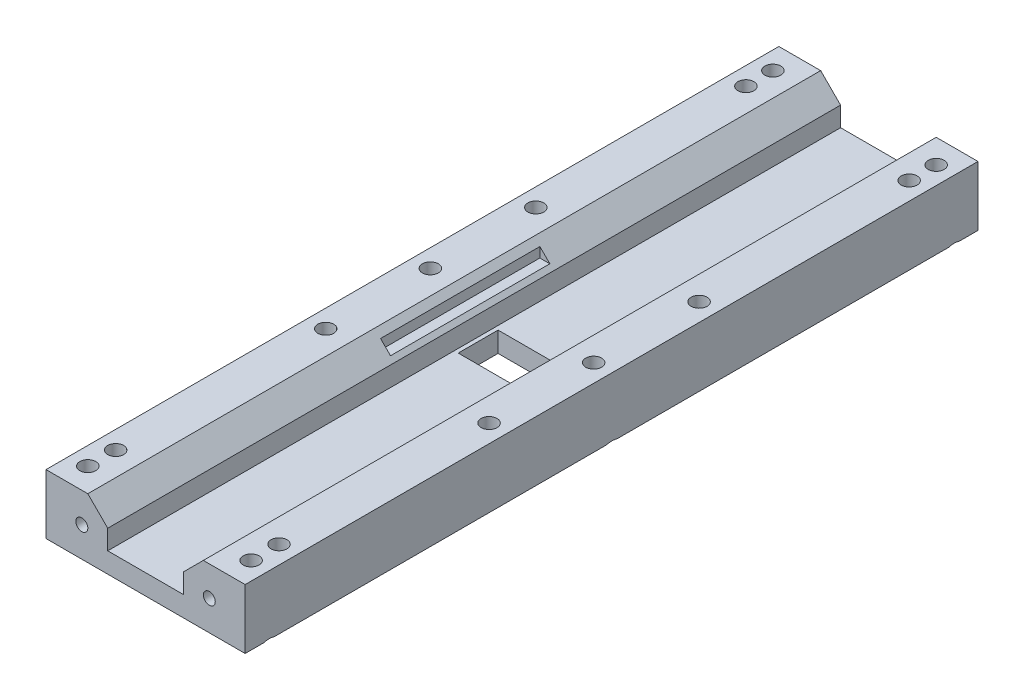
from build123d import *

# Parameters (mm, degrees)
BOSS_EXTRU_1_DEPTH       = 184
ESQUISSE2_R              = 2
ENL_V_MAT_EXTRU_1_DEPTH  = 205.56
ESQUISSE4_R              = 2
ENL_V_MAT_EXTRU_2_DEPTH  = 205.56
CHANFREIN1_SIZE          = 2.7
ESQUISSE6_W              = 26
ESQUISSE6_H              = 40
ENL_V_MAT_EXTRU_3_DEPTH  = 4
ESQUISSE8_W              = 17
ESQUISSE8_H              = 10
ENL_V_MAT_EXTRU_6_DEPTH  = 10
ESQUISSE7_R              = 1.5
ENL_V_MAT_EXTRU_5_DEPTH  = 5
ESQUISSE9_R              = 1.5
ENL_V_MAT_EXTRU_10_DEPTH = 5


with BuildPart() as part:
    # Esquisse1 → Boss.-Extru.1 (new body)
    with BuildSketch(Plane.XY):
        Polygon((0, 0), (50, 0), (50, 15), (39.5, 15), (34.5, 10), (34.5, 5.083005244), (15.5, 5.083005244), (15.5, 10), (10.5, 15), (0, 15), align=None)
    extrude(amount=BOSS_EXTRU_1_DEPTH)

    # Esquisse2 → Enlèv. mat.-Extru.1 (cut)
    with BuildSketch(Plane(origin=(0, 15, 0), x_dir=(-1, 0, 0), z_dir=(0, 1, 0))):
        with Locations(Location((-4.5, 12.78, 0), (0, 0, 90))):
            Circle(ESQUISSE2_R)
        with Locations(Location((-45.5, 12.78, 0), (0, 0, 90))):
            Circle(ESQUISSE2_R)
        with Locations(Location((-4.5, 65.52, 0), (0, 0, 90))):
            Circle(ESQUISSE2_R)
        with Locations(Location((-45.5, 65.52, 0), (0, 0, 90))):
            Circle(ESQUISSE2_R)
        with Locations(Location((-4.5, 118.26, 0), (0, 0, 90))):
            Circle(ESQUISSE2_R)
        with Locations(Location((-45.5, 118.26, 0), (0, 0, 90))):
            Circle(ESQUISSE2_R)
        with Locations(Location((-4.5, 171, 0), (0, 0, 90))):
            Circle(ESQUISSE2_R)
        with Locations(Location((-45.5, 171, 0), (0, 0, 90))):
            Circle(ESQUISSE2_R)
    extrude(amount=-ENL_V_MAT_EXTRU_1_DEPTH, mode=Mode.SUBTRACT)

    # Esquisse4 → Enlèv. mat.-Extru.2 (cut)
    with BuildSketch(Plane(origin=(0, 15, 0), x_dir=(-1, 0, 0), z_dir=(0, 1, 0))):
        with Locations(Location((-4.5, 6, 0), (0, 0, 90))):
            Circle(ESQUISSE4_R)
        with Locations(Location((-45.5, 6, 0), (0, 0, 90))):
            Circle(ESQUISSE4_R)
        with Locations(Location((-45.5, 178, 0), (0, 0, 90))):
            Circle(ESQUISSE4_R)
        with Locations(Location((-4.5, 178, 0), (0, 0, 90))):
            Circle(ESQUISSE4_R)
        with Locations(Location((-4.5, 92, 0), (0, 0, 90))):
            Circle(ESQUISSE4_R)
        with Locations(Location((-45.5, 92, 0), (0, 0, 90))):
            Circle(ESQUISSE4_R)
    extrude(amount=-ENL_V_MAT_EXTRU_2_DEPTH, mode=Mode.SUBTRACT)

    # Chanfrein1
    # the kernel refuses this chamfer: 2.7 mm, written as the material it takes off along each edge
    with BuildSketch(Plane(origin=(4.5, 0, 6), x_dir=(0, 0, 1), z_dir=(-1, 0, 0))) as chanfrein1_piece_1:
        Polygon((2 + CHANFREIN1_SIZE, 0), (2, CHANFREIN1_SIZE), (2, 0), align=None)
    revolve(axis=Axis((4.5, 0, 6), (0, 1, 0)), mode=Mode.SUBTRACT)
    with BuildSketch(Plane(origin=(45.5, 0, 6), x_dir=(0, 0, 1), z_dir=(-1, 0, 0))) as chanfrein1_piece_2:
        Polygon((2 + CHANFREIN1_SIZE, 0), (2, CHANFREIN1_SIZE), (2, 0), align=None)
    revolve(axis=Axis((45.5, 0, 6), (0, 1, 0)), mode=Mode.SUBTRACT)
    with BuildSketch(Plane(origin=(45.5, 0, 178), x_dir=(0, 0, 1), z_dir=(-1, 0, 0))) as chanfrein1_piece_3:
        Polygon((2 + CHANFREIN1_SIZE, 0), (2, CHANFREIN1_SIZE), (2, 0), align=None)
    revolve(axis=Axis((45.5, 0, 178), (0, 1, 0)), mode=Mode.SUBTRACT)
    with BuildSketch(Plane(origin=(4.5, 0, 178), x_dir=(0, 0, 1), z_dir=(-1, 0, 0))) as chanfrein1_piece_4:
        Polygon((2 + CHANFREIN1_SIZE, 0), (2, CHANFREIN1_SIZE), (2, 0), align=None)
    revolve(axis=Axis((4.5, 0, 178), (0, 1, 0)), mode=Mode.SUBTRACT)
    with BuildSketch(Plane(origin=(4.5, 0, 92), x_dir=(0, 0, 1), z_dir=(-1, 0, 0))) as chanfrein1_piece_5:
        Polygon((2 + CHANFREIN1_SIZE, 0), (2, CHANFREIN1_SIZE), (2, 0), align=None)
    revolve(axis=Axis((4.5, 0, 92), (0, 1, 0)), mode=Mode.SUBTRACT)
    with BuildSketch(Plane(origin=(45.5, 0, 92), x_dir=(0, 0, 1), z_dir=(-1, 0, 0))) as chanfrein1_piece_6:
        Polygon((2 + CHANFREIN1_SIZE, 0), (2, CHANFREIN1_SIZE), (2, 0), align=None)
    revolve(axis=Axis((45.5, 0, 92), (0, 1, 0)), mode=Mode.SUBTRACT)

    # Esquisse6 → Enlèv. mat.-Extru.3 (cut)
    with BuildSketch(Plane(origin=(0, 15, 0), x_dir=(1, 0, 0), z_dir=(0, 1, 0))):
        with Locations((25, -92)):
            Rectangle(ESQUISSE6_W, ESQUISSE6_H)
    extrude(amount=-ENL_V_MAT_EXTRU_3_DEPTH, mode=Mode.SUBTRACT)

    # Esquisse8 → Enlèv. mat.-Extru.6 (cut)
    with BuildSketch(Plane(origin=(0, 5.083005244, 0), x_dir=(1, 0, 0), z_dir=(0, 1, 0))):
        with Locations((25, -92)):
            Rectangle(ESQUISSE8_W, ESQUISSE8_H)
    extrude(amount=-ENL_V_MAT_EXTRU_6_DEPTH, mode=Mode.SUBTRACT)

    # Esquisse7 → Enlèv. mat.-Extru.5 (cut)
    with BuildSketch(Plane.XY.offset(184)):
        with Locations((9, 7.5)):
            Circle(ESQUISSE7_R)
        with Locations((41, 7.5)):
            Circle(ESQUISSE7_R)
    extrude(amount=-ENL_V_MAT_EXTRU_5_DEPTH, mode=Mode.SUBTRACT)

    # Esquisse9 → Enlèv. mat.-Extru.10 (cut)
    with BuildSketch(Plane(origin=(0, 0, 0), x_dir=(-1, 0, 0), z_dir=(0, 0, -1))):
        with Locations((-42.5, 7.5)):
            Circle(ESQUISSE9_R)
        with Locations((-7.5, 7.5)):
            Circle(ESQUISSE9_R)
    extrude(amount=-ENL_V_MAT_EXTRU_10_DEPTH, mode=Mode.SUBTRACT)


solid = part.part
